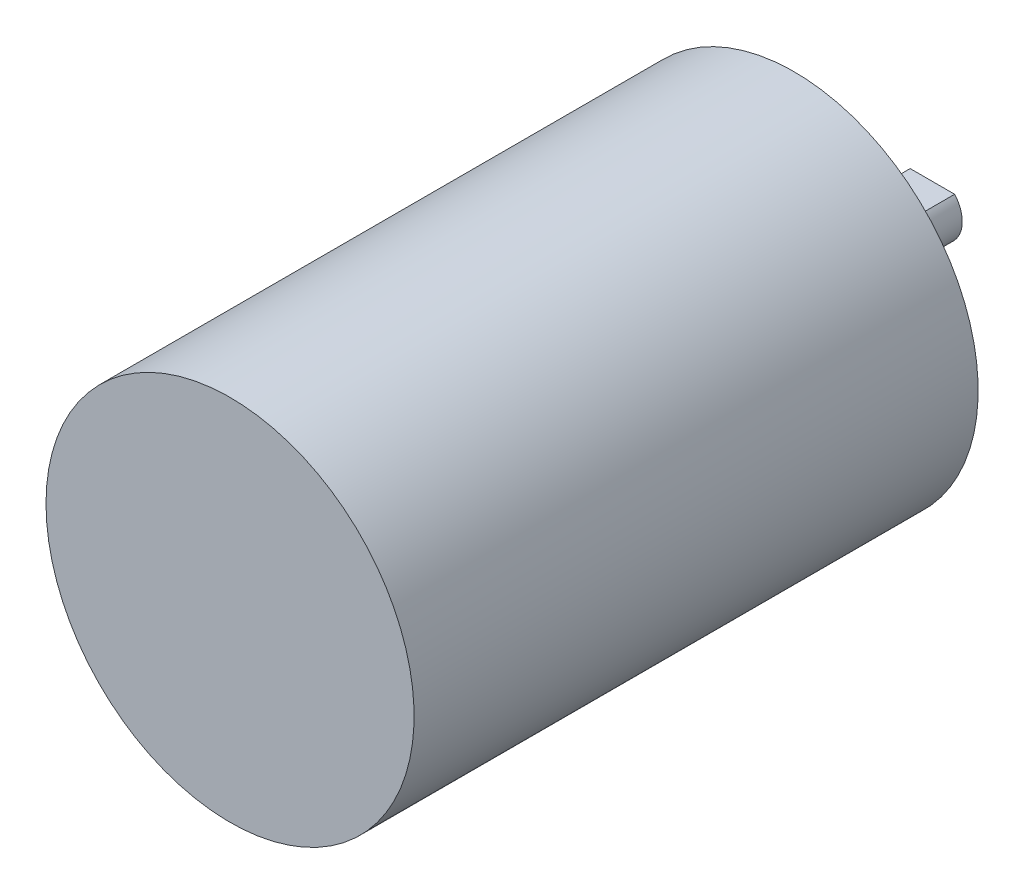
from build123d import *

# Parameters (mm, degrees)
SKETCH1_R           = 18.5
BOSS_EXTRUDE1_DEPTH = 56.7
SKETCH3_R           = 6
BOSS_EXTRUDE2_DEPTH = 3.5
SKETCH4_R           = 3
BOSS_EXTRUDE3_DEPTH = 10.4
CUT_EXTRUDE1_START  = -8
CUT_EXTRUDE1_DEPTH  = 8


with BuildPart() as part:
    # Sketch1 → Boss-Extrude1 (new body)
    with BuildSketch(Plane.XY):
        Circle(SKETCH1_R)
    extrude(amount=BOSS_EXTRUDE1_DEPTH)

    # Sketch3 → Boss-Extrude2 (add)
    with BuildSketch(Plane.XY):
        Circle(SKETCH3_R)
    extrude(amount=-BOSS_EXTRUDE2_DEPTH)

    # Sketch4 → Boss-Extrude3 (add)
    with BuildSketch(Plane(origin=(0, 0, -3.5), x_dir=(-1, 0, 0), z_dir=(0, 0, -1))):
        Circle(SKETCH4_R)
    extrude(amount=BOSS_EXTRUDE3_DEPTH)

    # Sketch5 → Cut-Extrude1 (cut)
    with BuildSketch(Plane(origin=(0, 0, -13.9), x_dir=(-1, 0, 0), z_dir=(0, 0, -1)).offset(CUT_EXTRUDE1_START)):
        with BuildLine():
            Line((-2.236067977, 2), (2.236067977, 2))
            ThreePointArc((2.236067977, 2), (0, 3), (-2.236067977, 2))
        make_face()
    extrude(amount=CUT_EXTRUDE1_DEPTH, mode=Mode.SUBTRACT)


solid = part.part
